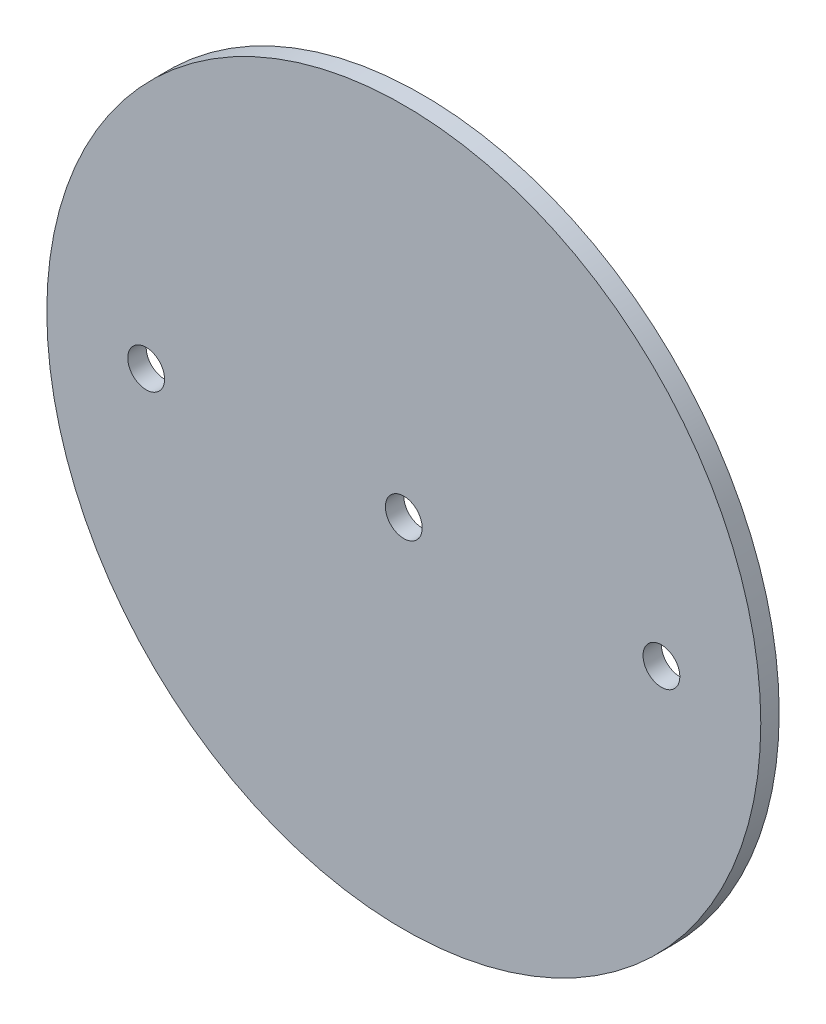
from build123d import *

# Parameters (mm, degrees)
SKETCH1_R                   = 61.595
BOSS_EXTRUDE1_DEPTH         = 1.5875
F_1_4_0_25_DIAMETER_HOLE1_D = 6.35


with BuildPart() as part:
    # Sketch1 → Boss-Extrude1 (new, symmetric)
    with BuildSketch(Plane.XY):
        Circle(SKETCH1_R)
    extrude(amount=BOSS_EXTRUDE1_DEPTH, both=True)

    # 1/4 (0.25) Diameter Hole1 (through all)
    with Locations(Plane.XY.offset(1.5875)):
        with Locations((-44.45, 0), (0, 0), (44.45, 0)):
            Hole(F_1_4_0_25_DIAMETER_HOLE1_D / 2)


solid = part.part
